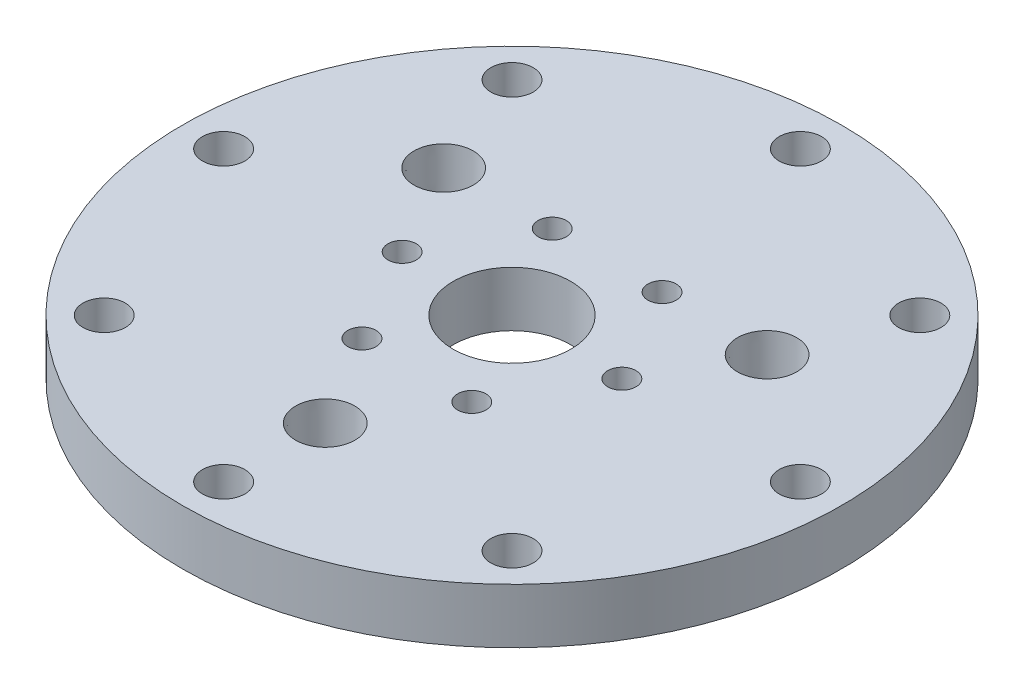
from build123d import *

# Parameters (mm, degrees)
SKETCH1_R                         = 76.2
BOSS_EXTRUDE1_DEPTH               = 12.7
F_3_8_CLEARANCE_HOLE1_D           = 9.8044
F_1_4_CLEARANCE_HOLE1_D           = 6.5278
F_1_4_NPT_TAPPED_HOLE1_AT_2_COUNT = 2
F_1_4_NPT_TAPPED_HOLE1_AT_2_PITCH = 74.789953871
F_1_4_NPT_TAPPED_HOLE1_AT_3_COUNT = 2
F_1_4_NPT_TAPPED_HOLE1_AT_3_PITCH = 74.789953871
SKETCH8_R                         = 13.6
CUT_EXTRUDE1_DEPTH                = 109.508847566


with BuildPart() as part:
    # Sketch1 → Boss-Extrude1 (new body)
    with BuildSketch(Plane(origin=(0, 0, 0), x_dir=(1, 0, 0), z_dir=(0, 1, 0))):
        Circle(SKETCH1_R)
    extrude(amount=BOSS_EXTRUDE1_DEPTH)

    # 3/8 Clearance Hole1 (through all)
    with Locations(Plane(origin=(0, 12.7, 0), x_dir=(1, 0, 0), z_dir=(0, 1, 0))):
        with Locations((47.146344636, -47.146344636), (66.675, 0), (47.146344636, 47.146344636), (0, 66.675), (-47.146344636, 47.146344636), (-66.675, 0), (-47.146344636, -47.146344636), (0, -66.675)):
            Hole(F_3_8_CLEARANCE_HOLE1_D / 2)

    # 1/4 Clearance Hole1 (through all)
    with Locations(Plane(origin=(0, 12.7, 0), x_dir=(1, 0, 0), z_dir=(0, 1, 0))):
        with Locations((12.7, -21.997045256), (25.4, 0), (12.7, 21.997045256), (-12.7, 21.997045256), (-25.4, 0), (-12.7, -21.997045256)):
            Hole(F_1_4_CLEARANCE_HOLE1_D / 2)

    # Sketch7 → 1/4 NPT Tapped Hole1 (revolve, cut)
    with BuildSketch(Plane(origin=(-37.394976935, 12.7, -21.59), x_dir=(0, 0, 1), z_dir=(1, 0, 0))):
        Polygon((0, 0), (0, 12.7), (5.5626, 12.7), (5.5626, 9.906), (6.557984794, 9.906), (6.8545837, 0), align=None)
    f_1_4_npt_tapped_hole1 = revolve(axis=Axis((-37.394976935, 19.05, -21.59), (0, -1, 0)), mode=Mode.SUBTRACT)

    # 1/4 NPT Tapped Hole1 at 2: 1/4 NPT Tapped Hole1 ×2
    with Locations(*[Vector(0.5000000000000003, 0, 0.8660254037844386) * (i * F_1_4_NPT_TAPPED_HOLE1_AT_2_PITCH) for i in range(1, F_1_4_NPT_TAPPED_HOLE1_AT_2_COUNT)]):
        add(f_1_4_npt_tapped_hole1, mode=Mode.SUBTRACT)

    # 1/4 NPT Tapped Hole1 at 3: 1/4 NPT Tapped Hole1 ×2
    with Locations(*[(i * F_1_4_NPT_TAPPED_HOLE1_AT_3_PITCH, 0, 0) for i in range(1, F_1_4_NPT_TAPPED_HOLE1_AT_3_COUNT)]):
        add(f_1_4_npt_tapped_hole1, mode=Mode.SUBTRACT)

    # Sketch8 → Cut-Extrude1 (cut, through all)
    with BuildSketch(Plane(origin=(0, 12.7, 0), x_dir=(1, 0, 0), z_dir=(0, 1, 0))):
        Circle(SKETCH8_R)
    extrude(amount=-CUT_EXTRUDE1_DEPTH, mode=Mode.SUBTRACT)


solid = part.part
